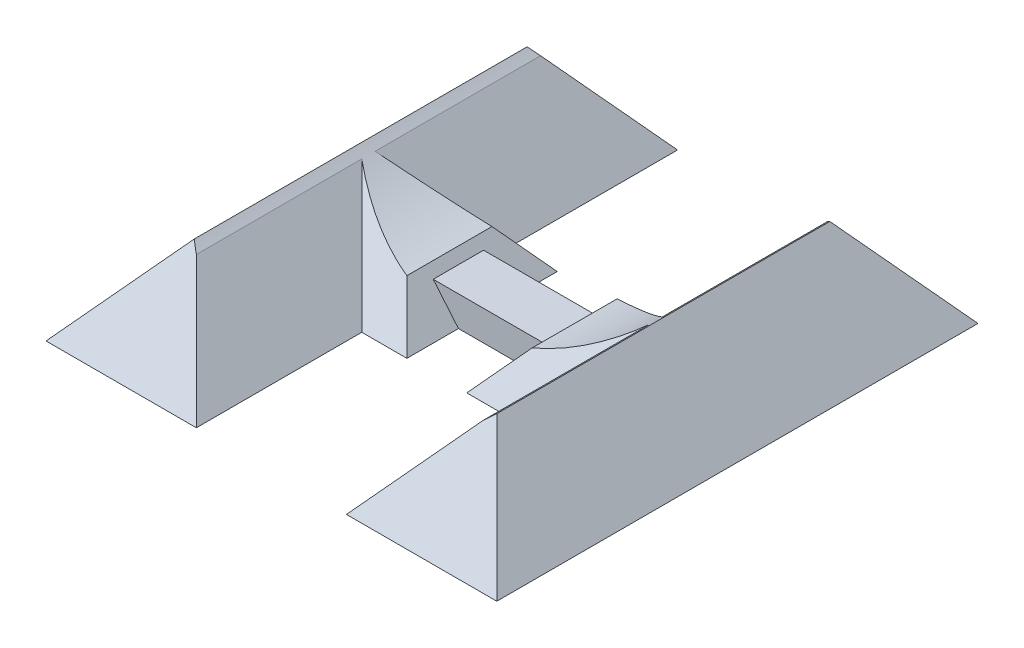
from build123d import *

# Parameters (mm, degrees)
BOSS_EXTRUDE1_START       = -105
BOSS_EXTRUDE1_DEPTH       = 160
BOSS_EXTRUDE1_2_DEPTH     = 40
BOSS_EXTRUDE1_START_2     = -20
BOSS_EXTRUDE1_3_OUTLINE_W = 48
BOSS_EXTRUDE1_3_OUTLINE_H = 147
BOSS_EXTRUDE1_3_DEPTH     = 20
BOSS_EXTRUDE1_START_3     = 42.132444372
BOSS_EXTRUDE1_4_OUTLINE_W = 52
BOSS_EXTRUDE1_4_OUTLINE_H = 116
BOSS_EXTRUDE1_4_DEPTH     = 19.867555628
BOSS_EXTRUDE1_START_4     = 80.434666527
BOSS_EXTRUDE1_5_OUTLINE_W = 52
BOSS_EXTRUDE1_5_OUTLINE_H = 117
BOSS_EXTRUDE1_5_DEPTH     = 20.565333473
SKETCH2_W                 = 21.285197014
SKETCH2_H                 = 16.738844255
BOSS_EXTRUDE2_DEPTH       = 10
SKETCH3_R                 = 75
CUT_EXTRUDE1_DEPTH        = 95


with BuildPart() as part:
    # Boss-Extrude1: read off the stored shape, not the designer's step
    # Boss-Extrude1 outline → Boss-Extrude1 (new body)
    with BuildSketch(Plane.XY.offset(BOSS_EXTRUDE1_START)):
        Polygon((65, 0), (40, 29.793839815), (15, 0), align=None)
    extrude(amount=BOSS_EXTRUDE1_DEPTH)

    # Boss-Extrude1 2 outline → Boss-Extrude1 2 (add)
    with BuildSketch(Plane.YZ):
        Polygon((0, -50), (29.793839815, -25), (0, 0), align=None)
    extrude(amount=BOSS_EXTRUDE1_2_DEPTH)

    # Boss-Extrude1 3 outline → Boss-Extrude1 3 (cut)
    with BuildSketch(Plane(origin=(0, 0, 0), x_dir=(0.6427876096865404, 0.7660444431189772, 0), z_dir=(0.7660444431189772, -0.6427876096865403, 0)).offset(BOSS_EXTRUDE1_START_2)):
        with Locations((22, -24.5)):
            Rectangle(BOSS_EXTRUDE1_3_OUTLINE_W, BOSS_EXTRUDE1_3_OUTLINE_H)
    extrude(amount=BOSS_EXTRUDE1_3_DEPTH, mode=Mode.SUBTRACT)

    # Boss-Extrude1 4 outline → Boss-Extrude1 4 (cut)
    with BuildSketch(Plane(origin=(0, 0, 0), x_dir=(1, 0, 0), z_dir=(0, 0.6427876096865403, 0.7660444431189772)).offset(BOSS_EXTRUDE1_START_3)):
        with Locations((40, 21)):
            Rectangle(BOSS_EXTRUDE1_4_OUTLINE_W, BOSS_EXTRUDE1_4_OUTLINE_H)
    extrude(amount=BOSS_EXTRUDE1_4_DEPTH, mode=Mode.SUBTRACT)

    # Boss-Extrude1 5 outline → Boss-Extrude1 5 (cut)
    with BuildSketch(Plane(origin=(0, 0, 0), x_dir=(1, 0, 0), z_dir=(0, 0.6427876096865403, -0.7660444431189772)).offset(BOSS_EXTRUDE1_START_4)):
        with Locations((40, 10.5)):
            Rectangle(BOSS_EXTRUDE1_5_OUTLINE_W, BOSS_EXTRUDE1_5_OUTLINE_H)
    extrude(amount=BOSS_EXTRUDE1_5_DEPTH, mode=Mode.SUBTRACT)

    # Sketch2 → Boss-Extrude2 (add)
    with BuildSketch(Plane.XZ):
        with Locations((0.693235287, -25.516630996)):
            Rectangle(SKETCH2_W, SKETCH2_H)
    extrude(amount=-BOSS_EXTRUDE2_DEPTH)

    # Mirror8: part across plane


with BuildPart() as part_1:
    add(part.part)
    add(part.part.mirror(Plane(origin=(-9.94936322, 10, -17.147208868), x_dir=(0, 0, 1), z_dir=(-1, 0, 0))))

    # Sketch3 → Cut-Extrude1 (cut, symmetric)
    with BuildSketch(Plane.XY):
        with Locations((-9.94936322, 85)):
            Circle(SKETCH3_R)
    extrude(amount=CUT_EXTRUDE1_DEPTH, both=True, mode=Mode.SUBTRACT)


solid = part_1.part
